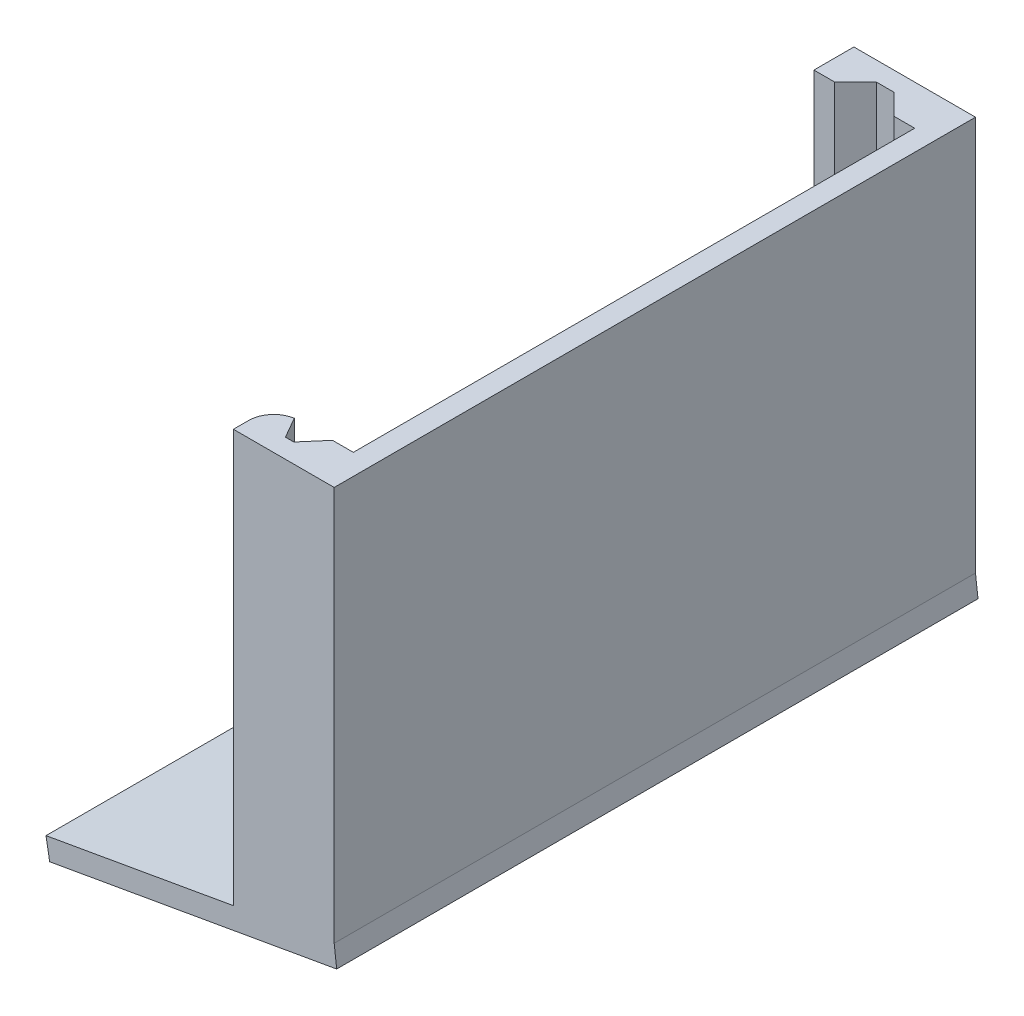
from build123d import *

# Parameters (mm, degrees)
SKETCH1_W                       = 30.734
SKETCH1_H                       = 196.596
BOSS_EXTRUDE1_DEPTH             = 0.0254
SKETCH22_W                      = 30.734
SKETCH22_H                      = 196.596
BOSS_EXTRUDE10_DEPTH            = 5.08
BOSS_EXTRUDE11_DEPTH            = 127
FILLET1_R                       = 7.62
BOSS_EXTRUDE3_REACH             = 227.812
SKETCH6_W                       = 6.35
SKETCH6_H                       = 132.08
BOSS_EXTRUDE3_DIRECTION_2_REACH = 227.812
BOSS_EXTRUDE7_REACH             = 238.982
SKETCH19_W                      = 19.05
SKETCH19_H                      = 19.05
CUT_EXTRUDE2_DEPTH              = 240.465115736
SKETCH20_W                      = 135.918968774
SKETCH20_H                      = 500.058977118
CUT_EXTRUDE3_DEPTH              = 153.162
CUT_EXTRUDE5_DEPTH              = 240.512169756
CUT_EXTRUDE6_DEPTH              = 248.87835803
CUT_EXTRUDE6_DEPTH_BACK         = 248.87835803
SKETCH29_W                      = 0.508
SKETCH29_H                      = 309.433656838
SKETCH29_H_2                    = 1270


with BuildPart() as part:
    # Sketch1 → Boss-Extrude1 (new body)
    with BuildSketch(Plane(origin=(0, 0, 0), x_dir=(1, 0, 0), z_dir=(0, 1, 0))):
        with Locations((15.367, 98.298)):
            Rectangle(SKETCH1_W, SKETCH1_H)
    extrude(amount=BOSS_EXTRUDE1_DEPTH)

    # Sketch22 → Boss-Extrude10 (add)
    with BuildSketch(Plane.XZ):
        with Locations((15.367, -98.298)):
            Rectangle(SKETCH22_W, SKETCH22_H)
    extrude(amount=BOSS_EXTRUDE10_DEPTH)

    # Sketch23 → Boss-Extrude11 (add)
    with BuildSketch(Plane(origin=(0, 0.0254, 0), x_dir=(1, 0, 0), z_dir=(0, 1, 0))):
        Polygon((0, 183.896), (6.35, 183.896), (12.7, 190.246), (18.034, 190.246), (24.384, 183.896), (30.734, 183.896), (30.734, 196.596), (0, 196.596), align=None)
        Polygon((30.734, 0), (6.350000064, 0), (6.366832231, 12.699988846), (12.716832231, 12.699988846), (16.383, 6.35), (18.923, 6.35), (24.384, 12.7), (30.734, 12.7), align=None)
    extrude(amount=BOSS_EXTRUDE11_DEPTH)

    # Fillet1
    # the kernel refuses this fillet: 7.62 mm, written as the material it takes off along each edge
    with BuildSketch(Plane(origin=(6.366832231, 0.0254, -12.699988846), x_dir=(1, 0, 0), z_dir=(0, 1, 0))) as fillet1_piece_1:
        with BuildLine():
            CenterArc((7.610046419, -7.515097007), FILLET1_R, 99.518172774, 80.405889243)
            Line((-0.009946888, -7.504997707), (0, 0))
            Line((0, 0), (6.35, 0))
        make_face()
    extrude(amount=145.762510746, mode=Mode.SUBTRACT)

    # Boss-Extrude3: up to this face of the body (flat: up to its plane)
    boss_extrude3_end = Plane(part.part.faces().sort_by_distance((18.388884901, 60.339992847, 0))[0])
    # Sketch6 → Boss-Extrude3 (add, up to the picked face)
    with BuildSketch(Plane.XY.offset(-184.15), mode=Mode.PRIVATE) as boss_extrude3_sk1:
        with Locations((33.909, 60.9854)):
            Rectangle(SKETCH6_W, SKETCH6_H)
    boss_extrude3_tool1 = split(extrude(boss_extrude3_sk1.sketch, amount=BOSS_EXTRUDE3_REACH, mode=Mode.PRIVATE), bisect_by=boss_extrude3_end, keep=Keep.BOTH, mode=Mode.PRIVATE)
    add(boss_extrude3_tool1.solids().sort_by(Axis((33.909, 60.9854, -184.15), (0, 0, 1)))[0])

    # Boss-Extrude3 direction 2: up to this face of the body (flat: up to its plane)
    boss_extrude3_direction_2_end = Plane(part.part.faces().sort_by_distance((15.367, 60.9727, -196.596))[0])
    # Sketch6 → Boss-Extrude3 direction 2 (add, up to the picked face)
    with BuildSketch(Plane.XY.offset(-184.15), mode=Mode.PRIVATE) as boss_extrude3_direction_2_sk1:
        with Locations((33.909, 60.9854)):
            Rectangle(SKETCH6_W, SKETCH6_H)
    boss_extrude3_direction_2_tool1 = split(extrude(boss_extrude3_direction_2_sk1.sketch, amount=-BOSS_EXTRUDE3_DIRECTION_2_REACH, mode=Mode.PRIVATE), bisect_by=boss_extrude3_direction_2_end, keep=Keep.BOTH, mode=Mode.PRIVATE)
    add(boss_extrude3_direction_2_tool1.solids().sort_by(Axis((33.909, 60.9854, -184.15), (0, 0, -1)))[0])

    # Boss-Extrude7: up to this face of the body (flat: up to its plane)
    boss_extrude7_end = Plane(part.part.faces().sort_by_distance((18.541494055, 60.974874311, -196.596))[0])
    # Sketch15 → Boss-Extrude7 (add, up to the picked face)
    with BuildSketch(Plane.XY, mode=Mode.PRIVATE) as boss_extrude7_sk1:
        Polygon((-50.8, -8.87193717), (-49.680323673, -15.22193717), (39.219676327, 0.453531415), (38.1, 6.803531415), align=None)
    boss_extrude7_tool1 = split(extrude(boss_extrude7_sk1.sketch, amount=-BOSS_EXTRUDE7_REACH, mode=Mode.PRIVATE), bisect_by=boss_extrude7_end, keep=Keep.BOTH, mode=Mode.PRIVATE)
    add(boss_extrude7_tool1.solids().sort_by(Axis((-5.790162, -4.209203, 0), (0, 0, -1)))[0])

    # Sketch19 → Cut-Extrude2 (cut, through all)
    with BuildSketch(Plane(origin=(-0.014616821, 0.08289611, 0), x_dir=(0.984807753012208, 0.1736481776669311, 0), z_dir=(-0.1736481776669311, 0.984807753012208, 0))):
        with Locations((-22.993829575, 168.021)):
            Rectangle(SKETCH19_W, SKETCH19_H)
        with Locations((-22.993829575, 142.621)):
            Rectangle(SKETCH19_W, SKETCH19_H)
        with Locations((-22.993829575, 117.221)):
            Rectangle(SKETCH19_W, SKETCH19_H)
        with Locations((-22.993829575, 91.821)):
            Rectangle(SKETCH19_W, SKETCH19_H)
        with Locations((-22.993829575, 66.421)):
            Rectangle(SKETCH19_W, SKETCH19_H)
    extrude(amount=-CUT_EXTRUDE2_DEPTH, mode=Mode.SUBTRACT)

    # Sketch20 → Cut-Extrude3 (cut)
    with BuildSketch(Plane(origin=(1.105059507, -6.26710389, 0), x_dir=(0.9848077530122079, 0.17364817766693127, 0), z_dir=(0.17364817766693127, -0.9848077530122079, 0))):
        with Locations((20.082569743, -64.610703306)):
            Rectangle(SKETCH20_W, SKETCH20_H)
    extrude(amount=CUT_EXTRUDE3_DEPTH, mode=Mode.SUBTRACT)

    # Sketch28 → Cut-Extrude5 (cut, through all)
    with BuildSketch(Plane.XY):
        Polygon((39.219676327, 0.453531415), (38.1, 6.803531415), (37.084, 6.624383203), (37.848330327, 0.211726115), align=None)
    extrude(amount=-CUT_EXTRUDE5_DEPTH, mode=Mode.SUBTRACT)

    # Sketch29 → Cut-Extrude6 (cut, two sides: drawn at the far end of the back side and taken through both)
    with BuildSketch(Plane(origin=(37.343053222, 4.450951877, 0), x_dir=(0, 0, -1), z_dir=(0.992971564369303, 0.11835316790850746, 0)).offset(-CUT_EXTRUDE6_DEPTH_BACK)):
        with Locations((0.254, 29.905643692)):
            Rectangle(SKETCH29_W, SKETCH29_H)
        with Locations((196.342, 626.49740635)):
            Rectangle(SKETCH29_W, SKETCH29_H_2)
    extrude(amount=CUT_EXTRUDE6_DEPTH + CUT_EXTRUDE6_DEPTH_BACK, mode=Mode.SUBTRACT)


solid = part.part
